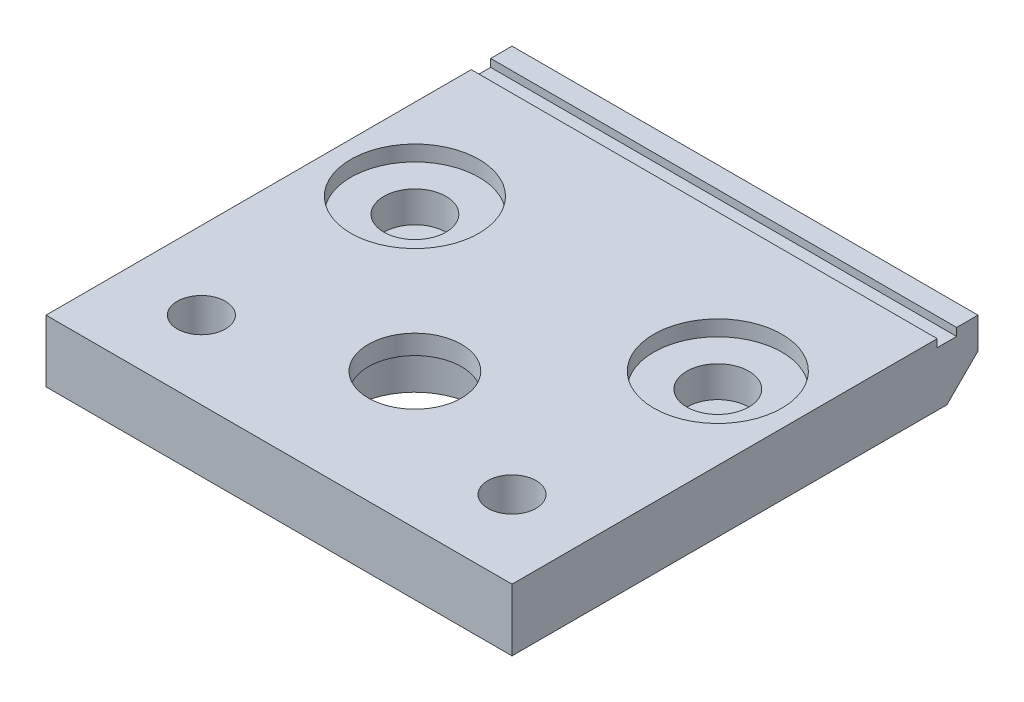
from build123d import *

# Parameters (mm, degrees)
SKETCH_1_W                = 60
SKETCH_1_H                = 60
SKETCH_1_R                = 2.75
SKETCH_1_R_2              = 6
EXTRUDE_1_DEPTH           = 8
SKETCH_3_R                = 4
CUT_EXTRUDE_2_DEPTH       = 6
SKETCH_1_3_R              = 8
SKETCH_1_3_R_2            = 6
CUT_EXTRUDE_4_DEPTH       = 5.5
SKETCH_6_R                = 8.25
CUT_EXTRUDE_5_DEPTH       = 2
CHAMFER_1_SIZE            = 4
HOLE_WIZARD_1_D           = 6.2
HOLE_WIZARD_1_CSINK_D     = 12.5
HOLE_WIZARD_1_CSINK_ANGLE = 90
SKETCH_8_W                = 2.5
SKETCH_8_H                = 1
CUT_EXTRUDE_6_DEPTH       = 68.557383016


with BuildPart() as part:
    # 草图1 → 凸台-拉伸1 (new body)
    with BuildSketch(Plane(origin=(0, 0, 0), x_dir=(1, 0, 0), z_dir=(0, 1, 0))):
        Rectangle(SKETCH_1_W, SKETCH_1_H)
        with Locations((-20, -20)):
            Circle(SKETCH_1_R, mode=Mode.SUBTRACT)
        with Locations((20, -20)):
            Circle(SKETCH_1_R, mode=Mode.SUBTRACT)
        with Locations((0, -12.5)):
            Circle(SKETCH_1_R_2, mode=Mode.SUBTRACT)
    extrude(amount=EXTRUDE_1_DEPTH)

    # 草图3 → 切除-拉伸2 (cut)
    with BuildSketch(Plane(origin=(0, 8, 0), x_dir=(1, 0, 0), z_dir=(0, 1, 0))):
        with Locations((-19.5, 7)):
            Circle(SKETCH_3_R)
        with Locations((19.5, 7)):
            Circle(SKETCH_3_R)
    extrude(amount=-CUT_EXTRUDE_2_DEPTH, mode=Mode.SUBTRACT)

    # 草图1<3> → 切除-拉伸4 (cut)
    with BuildSketch(Plane(origin=(0, 0, 0), x_dir=(1, 0, 0), z_dir=(0, 1, 0))):
        with Locations((0, -12.5)):
            Circle(SKETCH_1_3_R)
        with Locations((0, -12.5)):
            Circle(SKETCH_1_3_R_2, mode=Mode.SUBTRACT)
    extrude(amount=CUT_EXTRUDE_4_DEPTH, mode=Mode.SUBTRACT)

    # 草图6 → 切除-拉伸5 (cut)
    with BuildSketch(Plane(origin=(0, 8, 0), x_dir=(1, 0, 0), z_dir=(0, 1, 0))):
        with Locations((-19.5, 7)):
            Circle(SKETCH_6_R)
        with Locations((19.5, 7)):
            Circle(SKETCH_6_R)
    extrude(amount=-CUT_EXTRUDE_5_DEPTH, mode=Mode.SUBTRACT)

    # 倒角1
    chamfer_1_edges = [part.edges().sort_by_distance(p)[0] for p in [
        (0, 0, -30),
    ]]
    chamfer(chamfer_1_edges, length=CHAMFER_1_SIZE)

    # 打孔尺寸(%根据十字)槽半沉头木螺钉的类型1 (through all)
    with Locations(Plane(origin=(-20, 0, 20), x_dir=(0, 0, -1), z_dir=(0, -1, 0))):
        with Locations((0, 0), (0, 40)):
            CounterSinkHole(HOLE_WIZARD_1_D / 2, HOLE_WIZARD_1_CSINK_D / 2, counter_sink_angle=HOLE_WIZARD_1_CSINK_ANGLE)

    # 草图8 → 切除-拉伸6 (cut, through all)
    with BuildSketch(Plane(origin=(30, 0, 0), x_dir=(0, 0, -1), z_dir=(1, 0, 0))):
        with Locations((26, 7.5)):
            Rectangle(SKETCH_8_W, SKETCH_8_H)
    extrude(amount=-CUT_EXTRUDE_6_DEPTH, mode=Mode.SUBTRACT)


solid = part.part
